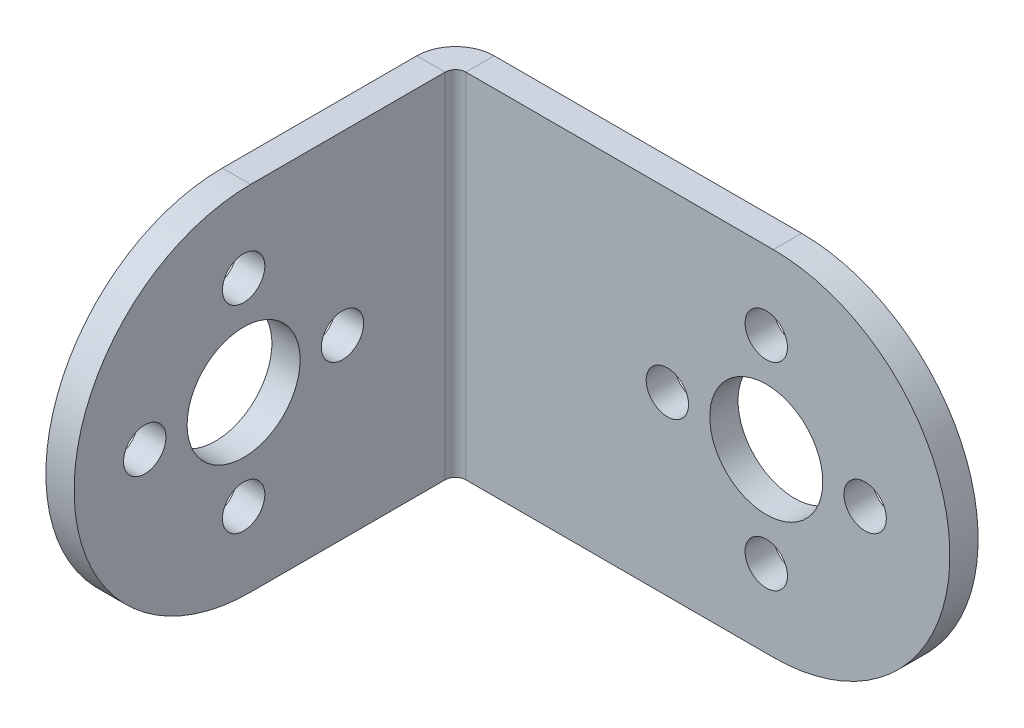
from build123d import *

# Parameters (mm, degrees)
SKETCH_1_R                       = 4
SKETCH_1_R_2                     = 1.5
SM_BASE_FLANGE_1_DEPTH           = 2
SM_EDGE_FLANGE_1_STRIP_W         = 9.4732
SM_EDGE_FLANGE_1_STRIP_H         = 2
SM_EDGE_FLANGE_1_STRIP_CUT_DEPTH = 25
SM_EDGE_FLANGE_1_DEPTH           = 25
SKETCH_9_R                       = 4
SKETCH_9_R_2                     = 1.5
CUT_EXTRUDE_1_DEPTH              = 10


# Sheet-metal steps are written as plain solids
with BuildPart() as part:
    # Sketch 1 → 基体-法兰1 (new body)
    with BuildSketch(Plane.XY):
        with BuildLine():
            Line((0, 0), (0, -25))
            Line((0, -25), (24.5, -25))
            ThreePointArc((24.5, -25), (37, -12.5), (24.5, 0))
            Line((24.5, 0), (0, 0))
        make_face()
        with Locations((24, -12.5)):
            Circle(SKETCH_1_R, mode=Mode.SUBTRACT)
        with Locations((17, -12.5)):
            Circle(SKETCH_1_R_2, mode=Mode.SUBTRACT)
        with Locations((31, -12.5)):
            Circle(SKETCH_1_R_2, mode=Mode.SUBTRACT)
        with Locations((24, -19.5)):
            Circle(SKETCH_1_R_2, mode=Mode.SUBTRACT)
        with Locations((24, -5.5)):
            Circle(SKETCH_1_R_2, mode=Mode.SUBTRACT)
    extrude(amount=-SM_BASE_FLANGE_1_DEPTH)

    # 边线-法兰1 strip (across the edge) → 边线-法兰1 strip cut (cut)
    with BuildSketch(Plane.XZ):
        with Locations((-2, -1)):
            Rectangle(SM_EDGE_FLANGE_1_STRIP_W, SM_EDGE_FLANGE_1_STRIP_H)
    extrude(amount=SM_EDGE_FLANGE_1_STRIP_CUT_DEPTH, mode=Mode.SUBTRACT)

    # 边线-法兰1 section (across the edge) → 边线-法兰1 (add)
    with BuildSketch(Plane.XZ):
        with BuildLine():
            Line((0, 0.7366), (0, 28))
            Line((0, 28), (2, 28))
            Line((2, 28), (2, 0.7366))
            ThreePointArc((2, 0.7366), (2.215745145, 0.215745145), (2.7366, 0))
            Line((2.7366, 0), (2.7366, -2))
            ThreePointArc((2.7366, -2), (0.801531583, -1.198468417), (0, 0.7366))
        make_face()
    extrude(amount=SM_EDGE_FLANGE_1_DEPTH)

    # 草图9 → 切除-拉伸1 (cut)
    with BuildSketch(Plane.ZY):
        with Locations((15, -12.5)):
            Circle(SKETCH_9_R)
        with Locations((22, -12.5)):
            Circle(SKETCH_9_R_2)
        with Locations((8, -12.5)):
            Circle(SKETCH_9_R_2)
        with Locations((15, -19.5)):
            Circle(SKETCH_9_R_2)
        with Locations((15, -5.5)):
            Circle(SKETCH_9_R_2)
        with BuildLine():
            Line((14.5, 0), (28, 0))
            Line((28, 0), (28, -25))
            Line((28, -25), (14.5, -25))
            ThreePointArc((14.5, -25), (27, -12.5), (14.5, 0))
        make_face()
    extrude(amount=-CUT_EXTRUDE_1_DEPTH, mode=Mode.SUBTRACT)


solid = part.part
